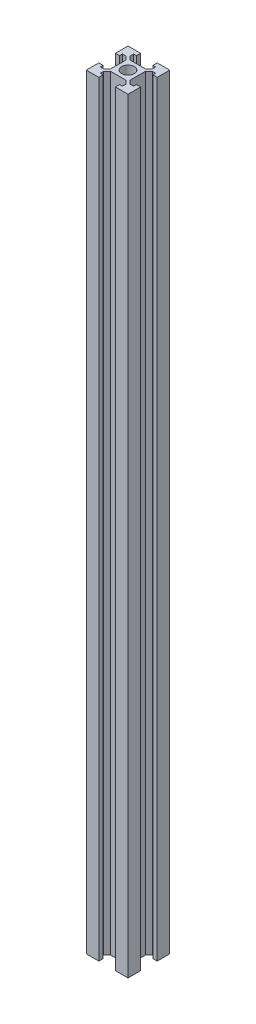
from build123d import *

# Parameters (mm, degrees)
SKETCH1_R           = 9
BOSS_EXTRUDE1_DEPTH = 1100


with BuildPart() as part:
    # Sketch1 → Boss-Extrude1 (new body)
    with BuildSketch(Plane(origin=(0, 0, 0), x_dir=(1, 0, 0), z_dir=(0, 1, 0))):
        Polygon((-30, 30), (-12, 30), (-12, 24), (-16, 24), (-16, 19), (-11, 14), (11, 14), (16, 19), (16, 24), (12, 24), (12, 30), (30, 30), (30, 12), (24, 12), (24, 16), (19, 16), (14, 11), (14, -11), (19, -16), (24, -16), (24, -12), (30, -12), (30, -30), (12, -30), (12, -24), (16, -24), (16, -19), (11, -14), (-11, -14), (-16, -19), (-16, -24), (-12, -24), (-12, -30), (-30, -30), (-30, -12), (-24, -12), (-24, -16), (-19, -16), (-14, -11), (-14, 11), (-19, 16), (-24, 16), (-24, 12), (-30, 12), align=None)
        Circle(SKETCH1_R, mode=Mode.SUBTRACT)
    extrude(amount=BOSS_EXTRUDE1_DEPTH)


solid = part.part
